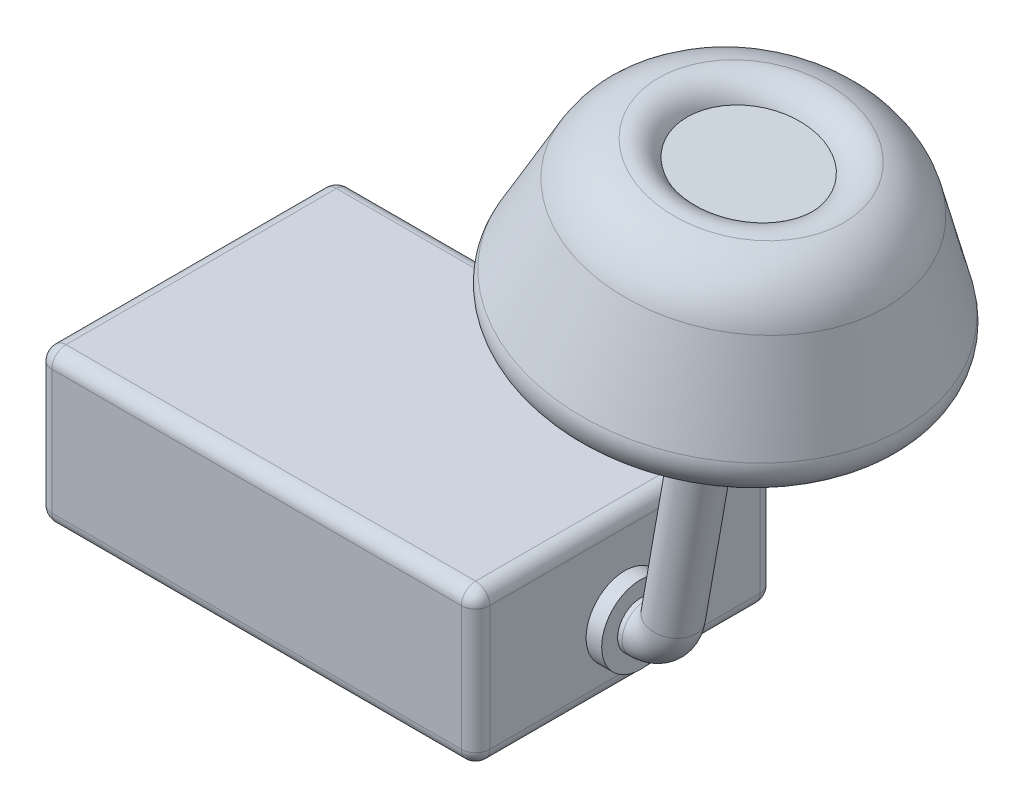
from build123d import *

# Parameters (mm, degrees)
SKETCH1_W           = 39.1668
SKETCH1_H           = 26.7208
BOSS_EXTRUDE1_DEPTH = 13.6652
SKETCH2_R           = 3.4798
BOSS_EXTRUDE2_DEPTH = 1.397
SKETCH4_R           = 2.0574
SKETCH5_R           = 3.4036
BOSS_EXTRUDE3_DEPTH = 8.89
SKETCH6_R           = 17.145
BOSS_EXTRUDE4_DEPTH = 15.8242
BOSS_EXTRUDE4_TAPER = 20
SKETCH7_R           = 5.588
CUT_EXTRUDE1_DEPTH  = 1.4478
FILLET1_R           = 2.54
FILLET2_R           = 6.35
FILLET3_R           = 2.54
FILLET4_R           = 1.27


with BuildPart() as part:
    # Sketch1 → Boss-Extrude1 (new body)
    with BuildSketch(Plane(origin=(0, 0, 0), x_dir=(1, 0, 0), z_dir=(0, 1, 0))):
        Rectangle(SKETCH1_W, SKETCH1_H)
    extrude(amount=BOSS_EXTRUDE1_DEPTH)

    # Sketch2 → Boss-Extrude2 (add)
    with BuildSketch(Plane(origin=(19.5834, 0, 0), x_dir=(0, 0, -1), z_dir=(1, 0, 0))):
        with Locations(Location((0, 5.588, 0), (0, 0, 180))):
            Circle(SKETCH2_R)
    extrude(amount=BOSS_EXTRUDE2_DEPTH)

    # Sweep1: sweep along a path in Sketch3
    with BuildLine(Plane.XY) as sweep1_path:
        Line((20.9804, 5.588), (21.389086937, 5.588))
        ThreePointArc((21.389086937, 5.588), (23.021767465, 6.182247114), (23.890498629, 7.686933629))
        Line((23.890498629, 7.686933629), (26.166798228, 20.596470156))
        Line((26.166798228, 20.596470156), (26.607864599, 23.097881849))
    # Sketch4 → Sweep1 (sweep)
    with BuildSketch(Plane(origin=(20.9804, 0, 0), x_dir=(0, 0, -1), z_dir=(1, 0, 0))):
        with Locations((0, 5.588)):
            Circle(SKETCH4_R)
    sweep(path=sweep1_path.line)

    # Sketch5 → Boss-Extrude3 (add)
    with BuildSketch(Plane(origin=(4.75229572, 26.951608321, 0), x_dir=(0.9848077530122086, -0.1736481776669279, 0), z_dir=(0.17364817766692786, 0.9848077530122085, 0))):
        with Locations(Location((22.192726257, 0, 0), (0, 0, 180))):
            Circle(SKETCH5_R)
    extrude(amount=BOSS_EXTRUDE3_DEPTH)

    # Sketch6 → Boss-Extrude4 (add)
    with BuildSketch(Plane(origin=(6.29602802, 35.706549245, 0), x_dir=(0.9848077530122085, -0.17364817766692792, 0), z_dir=(0.17364817766692792, 0.9848077530122085, 0))):
        with Locations((22.192726257, 0)):
            Circle(SKETCH6_R)
    extrude(amount=BOSS_EXTRUDE4_DEPTH, taper=BOSS_EXTRUDE4_TAPER)

    # Sketch7 → Cut-Extrude1 (cut)
    with BuildSketch(Plane(origin=(9.043871513, 51.29034409, 0), x_dir=(0.9848077530122085, -0.17364817766692794, 0), z_dir=(0.17364817766692794, 0.9848077530122086, 0))):
        with Locations(Location((22.192726257, 0, 0), (0, 0, 180))):
            Circle(SKETCH7_R)
    extrude(amount=-CUT_EXTRUDE1_DEPTH, mode=Mode.SUBTRACT)

    # Fillet1
    fillet1_edges = [part.edges().sort_by_distance(p)[0] for p in [
        (31.503488567, 31.261793835, 0),
        (11.267067973, 34.830020779, 0),
    ]]
    fillet(fillet1_edges, radius=FILLET1_R)

    # Fillet2
    fillet2_edges = [part.edges().sort_by_distance(p)[0] for p in [
        (19.686948927, 49.413682384, 0),
    ]]
    fillet(fillet2_edges, radius=FILLET2_R)

    # Fillet3
    # the kernel refuses this fillet: 2.54 mm, written as the material it takes off along each edge
    with BuildSketch(Plane(origin=(30.899440391, 47.436617618, 0), x_dir=(-0.9848077530122086, 0.1736481776669277, 0), z_dir=(0, 0, -1))) as fillet3_piece_1:
        with BuildLine():
            CenterArc((7.82807764, -2.645152148), FILLET3_R, 76.507632873, 75.367253658)
            Line((5.588, -1.4478), (5.363992236, -1.328064785))
            ThreePointArc((5.363992236, -1.328064785), (5.334, -0.7239), (5.334, 0))
            Line((5.334, 0), (5.588, 0.254))
            ThreePointArc((5.588, 0.254), (6.939144351, 0.254), (8.479962052, 0.071736277))
            Line((8.479962052, 0.071736277), (8.420699833, -0.17525358))
        make_face()
    revolve(axis=Axis((30.899440391, 47.436617618, 0), (0.17364817766692794, 0.9848077530122086, 0)), mode=Mode.SUBTRACT)

    # Fillet4
    fillet4_edges = [part.edges().sort_by_distance(p)[0] for p in [
        (19.5834, 13.6652, 0),
        (0, 13.6652, -13.3604),
        (-19.5834, 13.6652, 0),
        (0, 0, -13.3604),
        (19.5834, 0, 0),
        (0, 0, 13.3604),
        (-19.5834, 0, 0),
        (0, 13.6652, 13.3604),
        (-19.5834, 6.8326, -13.3604),
        (19.5834, 6.8326, -13.3604),
        (19.5834, 6.8326, 13.3604),
        (-19.5834, 6.8326, 13.3604),
    ]]
    fillet(fillet4_edges, radius=FILLET4_R)


solid = part.part
